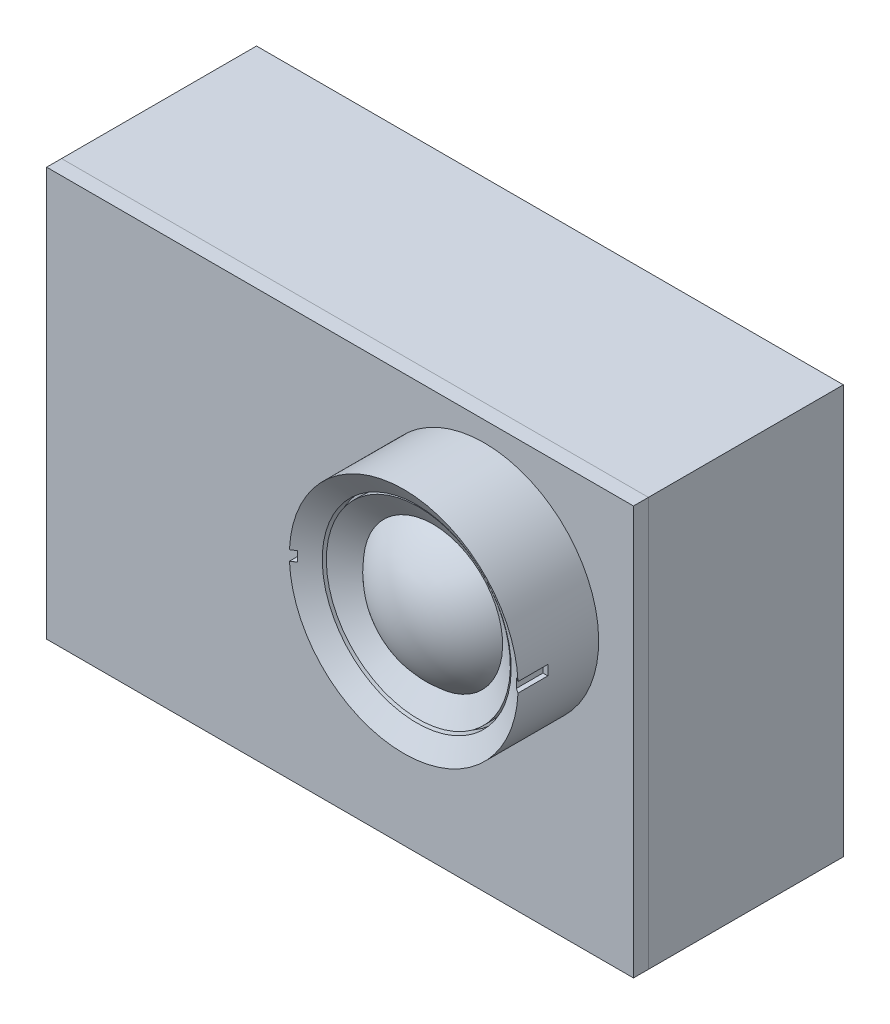
from build123d import *

# Parameters (mm, degrees)
SKETCH1_W           = 59
SKETCH1_H           = 41.1
BOSS_EXTRUDE1_DEPTH = 19.6
SKETCH2_W           = 59
SKETCH2_H           = 41.1
BOSS_EXTRUDE2_DEPTH = 1.5
CUT_EXTRUDE2_START  = 8.1
SKETCH5_W           = 0.5
SKETCH5_H           = 1
CUT_EXTRUDE2_DEPTH  = 3


with BuildPart() as part:
    # Sketch1 → Boss-Extrude1 (new body)
    with BuildSketch(Plane.XY):
        Rectangle(SKETCH1_W, SKETCH1_H)
    extrude(amount=BOSS_EXTRUDE1_DEPTH)


with BuildPart() as body_2:
    # Sketch2 → Boss-Extrude2 (new body)
    with BuildSketch(Plane.XY.offset(19.6)):
        Rectangle(SKETCH2_W, SKETCH2_H)
    extrude(amount=BOSS_EXTRUDE2_DEPTH)

    # Sketch4 → Revolve1 (revolve)
    with BuildSketch(Plane(origin=(14.5, 0, 0), x_dir=(0, 0, -1), z_dir=(1, 0, 0))):
        with BuildLine():
            Line((-21.1, 7.05), (-29.6, 7.05))
            ThreePointArc((-29.6, 7.05), (-28.721320344, 10.928679656), (-26.256854249, 14.05))
            Line((-26.256854249, 14.05), (-27.728427125, 16.3))
            Line((-27.728427125, 16.3), (-26.891935222, 16.3))
            Line((-26.891935222, 16.3), (-26.891935222, 16.55))
            Line((-26.891935222, 16.55), (-27.891935222, 16.55))
            Line((-27.891935222, 16.55), (-29.2, 18.55))
            Line((-29.2, 18.55), (-21.1, 18.55))
            Line((-21.1, 18.55), (-21.1, 7.05))
        make_face()
    revolve(axis=Axis((14.5, 7.05, 21.1), (0, 0, 1)))

    # Sketch5 → Cut-Extrude2 (cut)
    with BuildSketch(Plane.XY.offset(21.1).offset(CUT_EXTRUDE2_START)):
        with Locations((25.75, 7.05)):
            Rectangle(SKETCH5_W, SKETCH5_H)
        with Locations((3.25, 7.05)):
            Rectangle(SKETCH5_W, SKETCH5_H)
    extrude(amount=-CUT_EXTRUDE2_DEPTH, mode=Mode.SUBTRACT)


solid = Compound([part.part, body_2.part])
